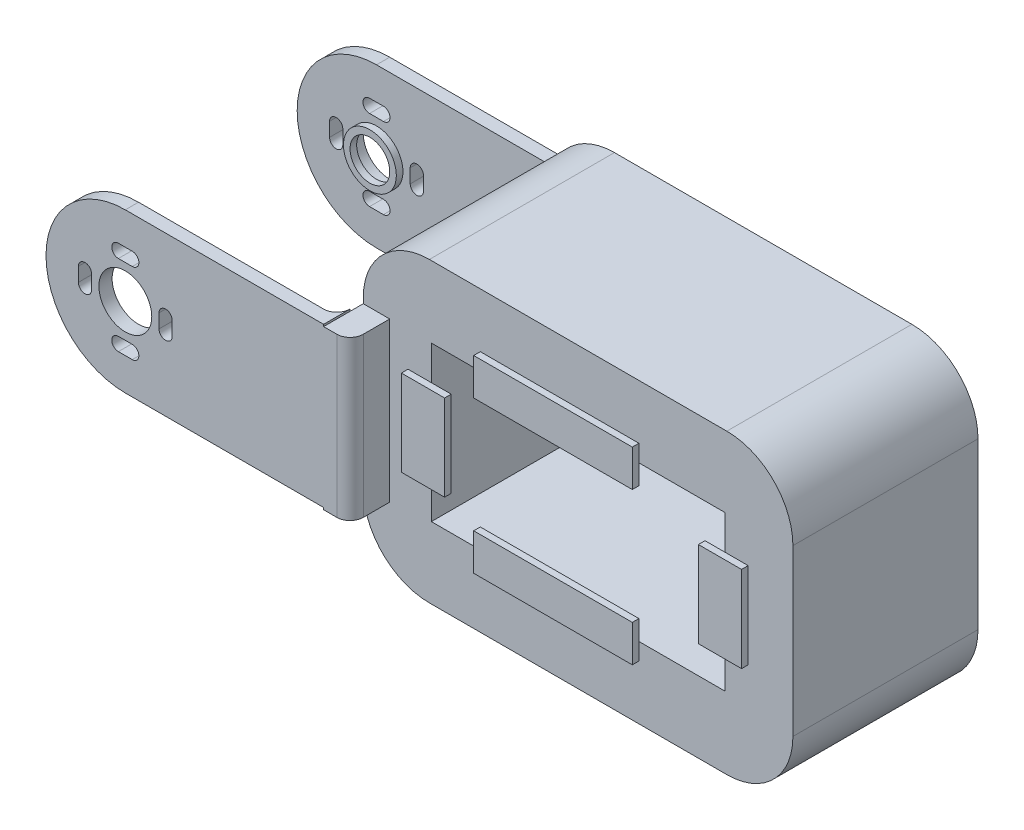
from build123d import *

# Parameters (mm, degrees)
SKETCH_1_W             = 65
SKETCH_1_H             = 45
EXTRUDE_1_DEPTH        = 28
SKETCH_2_W             = 44.4
SKETCH_2_H             = 23.4
CUT_EXTRUDE_1_DEPTH    = 39
SKETCH_3_W             = 4
SKETCH_3_H             = 24
EXTRUDE_2_DEPTH        = 6
SKETCH_7_R             = 4
EXTRUDE_3_DEPTH        = 1
SKETCH_8_W             = 4
SKETCH_8_H             = 24
EXTRUDE_4_DEPTH        = 6
FILLET_1_R             = 10
FILLET_2_R             = 10
FILLET_3_R             = 10
FILLET_4_R             = 10
PATTERN_LINEAR_2_COUNT = 2
PATTERN_LINEAR_2_PITCH = 38
FILLET_5_R             = 2
FILLET_6_R             = 2
FILLET_7_R             = 2
FILLET_8_R             = 2
SKETCH_9_R             = 4
SKETCH_9_R_2           = 3.004103595
EXTRUDE_5_DEPTH        = 1
EXTRUDE_6_DEPTH        = 1
EXTRUDE_6_2_DEPTH      = 1
EXTRUDE_6_3_DEPTH      = 1
EXTRUDE_6_4_DEPTH      = 1


with BuildPart() as part:
    # 草圖1 → 填料-伸長1 (new body)
    with BuildSketch(Plane.XY):
        with Locations((-27.434655272, 0)):
            Rectangle(SKETCH_1_W, SKETCH_1_H)
    extrude(amount=EXTRUDE_1_DEPTH)

    # 草圖2 → 除料-伸長1 (cut)
    with BuildSketch(Plane.XY):
        with Locations((-27.434655272, 0)):
            Rectangle(SKETCH_2_W, SKETCH_2_H)
    extrude(amount=CUT_EXTRUDE_1_DEPTH, mode=Mode.SUBTRACT)

    # 草圖3 → 填料-伸長2 (add)
    with BuildSketch(Plane.XY.offset(28)):
        with Locations((-57.934655272, -0.3)):
            Rectangle(SKETCH_3_W, SKETCH_3_H)
    extrude(amount=EXTRUDE_2_DEPTH)

    # 草圖7 → 填料-伸長3 (add, symmetric)
    with BuildSketch(Plane.XY.offset(33)):
        with BuildLine():
            Line((-59.934655272, 12), (-89.934655272, 12))
            ThreePointArc((-89.934655272, 12), (-101.934655272, 0), (-89.934655272, -12))
            Line((-89.934655272, -12), (-59.934655272, -12))
            Line((-59.934655272, -12), (-59.934655272, 12))
        make_face()
        with Locations((-89.934655272, 0)):
            Circle(SKETCH_7_R, mode=Mode.SUBTRACT)
        with BuildLine():
            Line((-95.034655272, 1.05), (-95.034655272, -1.05))
            ThreePointArc((-95.034655272, -1.05), (-96.034655272, -2.05), (-97.034655272, -1.05))
            Line((-97.034655272, -1.05), (-97.034655272, 1.05))
            ThreePointArc((-97.034655272, 1.05), (-96.034655272, 2.05), (-95.034655272, 1.05))
        make_face(mode=Mode.SUBTRACT)
        with BuildLine():
            Line((-90.984655272, -5.1), (-88.884655272, -5.1))
            ThreePointArc((-88.884655272, -5.1), (-87.884655272, -6.1), (-88.884655272, -7.1))
            Line((-88.884655272, -7.1), (-90.984655272, -7.1))
            ThreePointArc((-90.984655272, -7.1), (-91.984655272, -6.1), (-90.984655272, -5.1))
        make_face(mode=Mode.SUBTRACT)
        with BuildLine():
            Line((-90.984655272, 5.1), (-88.884655272, 5.1))
            ThreePointArc((-88.884655272, 5.1), (-87.884655272, 6.1), (-88.884655272, 7.1))
            Line((-88.884655272, 7.1), (-90.984655272, 7.1))
            ThreePointArc((-90.984655272, 7.1), (-91.984655272, 6.1), (-90.984655272, 5.1))
        make_face(mode=Mode.SUBTRACT)
        with BuildLine():
            Line((-84.834655272, 1.05), (-84.834655272, -1.05))
            ThreePointArc((-84.834655272, -1.05), (-83.834655272, -2.05), (-82.834655272, -1.05))
            Line((-82.834655272, -1.05), (-82.834655272, 1.05))
            ThreePointArc((-82.834655272, 1.05), (-83.834655272, 2.05), (-84.834655272, 1.05))
        make_face(mode=Mode.SUBTRACT)
    extrude_3 = extrude(amount=EXTRUDE_3_DEPTH, both=True)

    # 草圖8 → 填料-伸長4 (add)
    with BuildSketch(Plane(origin=(0, 0, 0), x_dir=(-1, 0, 0), z_dir=(0, 0, -1))):
        with Locations((57.934655272, 0)):
            Rectangle(SKETCH_8_W, SKETCH_8_H)
    extrude(amount=EXTRUDE_4_DEPTH)

    # 圓角1
    fillet_1_edges = [part.edges().sort_by_distance(p)[0] for p in [
        (-59.934655272, -22.5, 14),
    ]]
    fillet(fillet_1_edges, radius=FILLET_1_R)

    # 圓角2
    fillet_2_edges = [part.edges().sort_by_distance(p)[0] for p in [
        (-59.934655272, 22.5, 14),
    ]]
    fillet(fillet_2_edges, radius=FILLET_2_R)

    # 圓角3
    fillet_3_edges = [part.edges().sort_by_distance(p)[0] for p in [
        (5.065344728, 22.5, 14),
    ]]
    fillet(fillet_3_edges, radius=FILLET_3_R)

    # 圓角4
    fillet_4_edges = [part.edges().sort_by_distance(p)[0] for p in [
        (5.065344728, -22.5, 14),
    ]]
    fillet(fillet_4_edges, radius=FILLET_4_R)

    # 直線複製排列2: 填料-伸長3 ×2
    with Locations(*[(0, 0, -i * PATTERN_LINEAR_2_PITCH) for i in range(1, PATTERN_LINEAR_2_COUNT)]):
        add(extrude_3)

    # 圓角5
    fillet_5_edges = [part.edges().sort_by_distance(p)[0] for p in [
        (-55.934655272, 0, -6),
    ]]
    fillet(fillet_5_edges, radius=FILLET_5_R)

    # 圓角6
    fillet_6_edges = [part.edges().sort_by_distance(p)[0] for p in [
        (-59.934655272, 0, -4),
    ]]
    fillet(fillet_6_edges, radius=FILLET_6_R)

    # 圓角7
    # the kernel refuses this fillet: 2 mm, written as the material it adds along each edge
    with BuildSketch(Plane(origin=(-59.934655272, -12, 32), x_dir=(0, 0, -1), z_dir=(0, 1, 0))) as fillet_7_piece_1_section:
        with BuildLine():
            CenterArc((FILLET_7_R, FILLET_7_R), FILLET_7_R, 180, 90)
            Line((0, FILLET_7_R), (0, 0))
            Line((0, 0), (FILLET_7_R, 0))
        make_face()
    fillet_7_piece_1 = extrude(amount=23.7, mode=Mode.PRIVATE)
    fillet_7_piece_1 = split(fillet_7_piece_1, bisect_by=Plane(origin=(-59.934655272, -0.15, 31.593053741), z_dir=(-1, 0, 0)), keep=Keep.TOP, mode=Mode.PRIVATE)
    add(fillet_7_piece_1)
    with BuildSketch(Plane(origin=(-59.934655272, -12, 32), x_dir=(0, 0, -1), z_dir=(0, 1, 0))) as fillet_7_piece_2_section:
        with BuildLine():
            CenterArc((FILLET_7_R, FILLET_7_R), FILLET_7_R, 180, 90)
            Line((0, FILLET_7_R), (0, 0))
            Line((0, 0), (FILLET_7_R, 0))
        make_face()
    fillet_7_piece_2 = extrude(amount=28.7, mode=Mode.PRIVATE)
    fillet_7_piece_2 = split(fillet_7_piece_2, bisect_by=Plane(origin=(-60.428557372, 11.7, 31.593053741), z_dir=(0, 1, 0)), keep=Keep.TOP, mode=Mode.PRIVATE)
    fillet_7_piece_2 = split(fillet_7_piece_2, bisect_by=Plane(origin=(-59.934655272, 11.85, 31.593053741), z_dir=(-1, 0, 0)), keep=Keep.TOP, mode=Mode.PRIVATE)
    fillet_7_piece_2 = split(fillet_7_piece_2, bisect_by=Plane(origin=(-60.428557372, 12, 31.593053741), z_dir=(0, -1, 0)), keep=Keep.TOP, mode=Mode.PRIVATE)
    add(fillet_7_piece_2)

    # 圓角8
    fillet_8_edges = [part.edges().sort_by_distance(p)[0] for p in [
        (-55.934655272, -0.3, 34),
    ]]
    fillet(fillet_8_edges, radius=FILLET_8_R)


with BuildPart() as body_2:
    # 草圖9 → 填料-伸長5 (new body)
    with BuildSketch(Plane.XY.offset(-4)):
        with Locations((-89.934655272, 0)):
            Circle(SKETCH_9_R)
        with Locations((-89.934655272, 0)):
            Circle(SKETCH_9_R_2, mode=Mode.SUBTRACT)
    extrude(amount=EXTRUDE_5_DEPTH)


with BuildPart() as body_3:
    # 草圖10 → 填料-伸長6 (new body)
    with BuildSketch(Plane.XY.offset(29)):
        Polygon((-42.234655272, 11.7), (-42.234655272, 14.266291238), (-18.234655272, 14.266291238), (-18.234655272, 11.7), (-18.234655272, 8.7), (-42.234655272, 8.7), align=None)
    extrude(amount=-EXTRUDE_6_DEPTH)


with BuildPart() as body_4:
    # 草圖10 → Extrude 6 2 (new body)
    with BuildSketch(Plane.XY.offset(29)):
        Polygon((-49.634655272, 6.5), (-53.165057103, 6.5), (-53.165057103, -6.5), (-49.634655272, -6.5), (-46.634655272, -6.5), (-46.634655272, 6.5), align=None)
    extrude(amount=-EXTRUDE_6_2_DEPTH)


with BuildPart() as body_5:
    # 草圖10 → Extrude 6 3 (new body)
    with BuildSketch(Plane.XY.offset(29)):
        Polygon((-42.234655272, -11.7), (-42.234655272, -8.7), (-18.234655272, -8.7), (-18.234655272, -11.7), (-18.234655272, -14.266291238), (-42.234655272, -14.266291238), align=None)
    extrude(amount=-EXTRUDE_6_3_DEPTH)


with BuildPart() as body_6:
    # 草圖10 → Extrude 6 4 (new body)
    with BuildSketch(Plane.XY.offset(29)):
        Polygon((-5.234655272, 6.5), (-8.234655272, 6.5), (-8.234655272, -6.5), (-5.234655272, -6.5), (-1.70425344, -6.5), (-1.70425344, 6.5), align=None)
    extrude(amount=-EXTRUDE_6_4_DEPTH)


solid = Compound([part.part, body_2.part, body_3.part, body_4.part, body_5.part, body_6.part])
